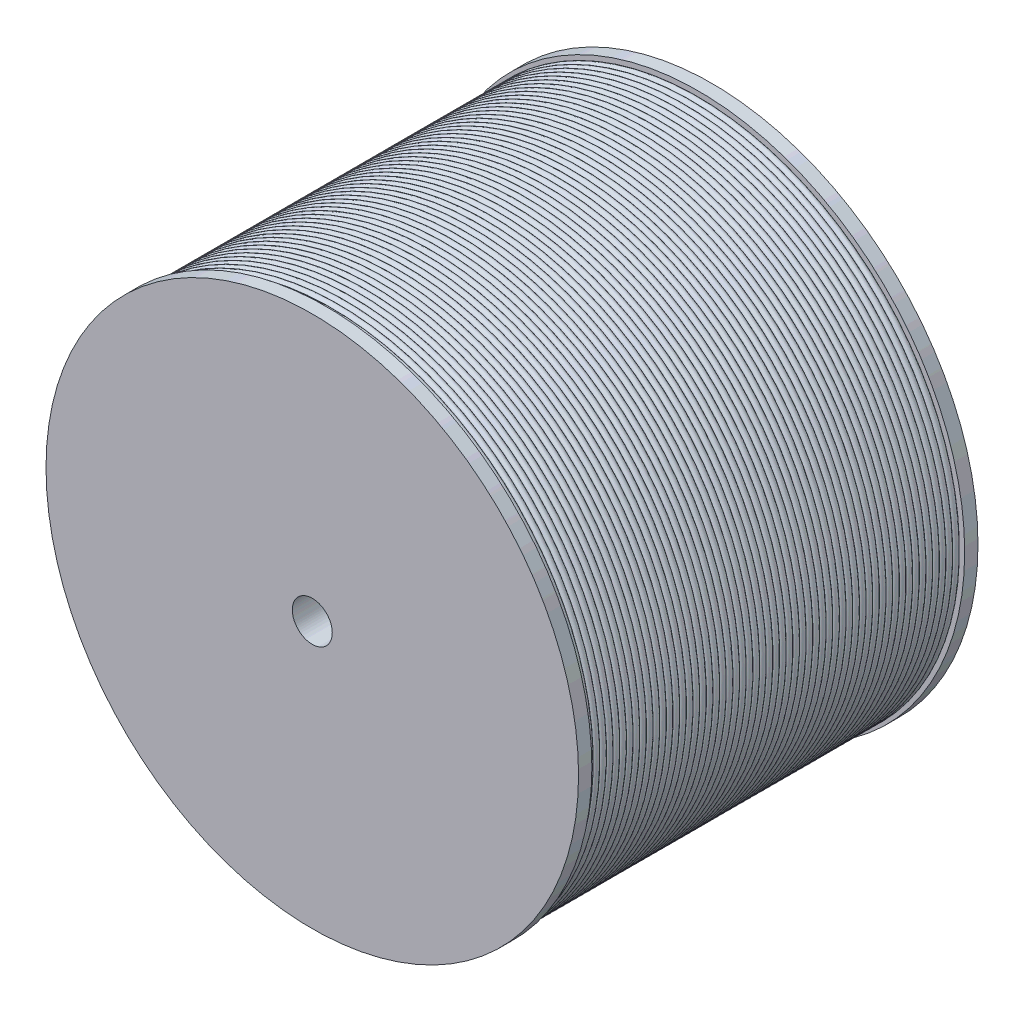
from build123d import *

# Parameters (mm, degrees)
SKETCH_3_R          = 3
CUT_EXTRUDE_1_DEPTH = 83.462112512


with BuildPart() as part:
    # Эскиз2 → Повернуть1 (revolve)
    with BuildSketch(Plane(origin=(0, 0, 0), x_dir=(0, 0, -1), z_dir=(1, 0, 0))):
        Polygon((0, 40), (0, 0), (60, 0), (60, 40), (58, 40), (58, 39), (58, 6), (2, 6), (2, 39), (2, 40), align=None)
    revolve(axis=Axis((0, 0, -60), (0, 0, 1)))

    # Эскиз2<4> → Повернуть2 (revolve)
    with BuildSketch(Plane(origin=(0, 0, 0), x_dir=(0, 0, -1), z_dir=(1, 0, 0))):
        with BuildLine():
            ThreePointArc((3, 39), (2.5, 39.5), (2, 39))
            Line((2, 39), (2, 6))
            Line((2, 6), (58, 6))
            Line((58, 6), (58, 39))
            ThreePointArc((58, 39), (57.5, 39.5), (57, 39))
            ThreePointArc((57, 39), (56.5, 39.5), (56, 39))
            ThreePointArc((56, 39), (55.5, 39.5), (55, 39))
            ThreePointArc((55, 39), (54.5, 39.5), (54, 39))
            ThreePointArc((54, 39), (53.5, 39.5), (53, 39))
            ThreePointArc((53, 39), (52.5, 39.5), (52, 39))
            ThreePointArc((52, 39), (51.5, 39.5), (51, 39))
            ThreePointArc((51, 39), (50.5, 39.5), (50, 39))
            ThreePointArc((50, 39), (49.5, 39.5), (49, 39))
            ThreePointArc((49, 39), (48.5, 39.5), (48, 39))
            ThreePointArc((48, 39), (47.5, 39.5), (47, 39))
            ThreePointArc((47, 39), (46.5, 39.5), (46, 39))
            ThreePointArc((46, 39), (45.5, 39.5), (45, 39))
            ThreePointArc((45, 39), (44.5, 39.5), (44, 39))
            ThreePointArc((44, 39), (43.5, 39.5), (43, 39))
            ThreePointArc((43, 39), (42.5, 39.5), (42, 39))
            ThreePointArc((42, 39), (41.5, 39.5), (41, 39))
            ThreePointArc((41, 39), (40.5, 39.5), (40, 39))
            ThreePointArc((40, 39), (39.5, 39.5), (39, 39))
            ThreePointArc((39, 39), (38.5, 39.5), (38, 39))
            ThreePointArc((38, 39), (37.5, 39.5), (37, 39))
            ThreePointArc((37, 39), (36.5, 39.5), (36, 39))
            ThreePointArc((36, 39), (35.5, 39.5), (35, 39))
            ThreePointArc((35, 39), (34.5, 39.5), (34, 39))
            ThreePointArc((34, 39), (33.5, 39.5), (33, 39))
            ThreePointArc((33, 39), (32.5, 39.5), (32, 39))
            ThreePointArc((32, 39), (31.5, 39.5), (31, 39))
            ThreePointArc((31, 39), (30.5, 39.5), (30, 39))
            ThreePointArc((30, 39), (29.5, 39.5), (29, 39))
            ThreePointArc((29, 39), (28.5, 39.5), (28, 39))
            ThreePointArc((28, 39), (27.5, 39.5), (27, 39))
            ThreePointArc((27, 39), (26.5, 39.5), (26, 39))
            ThreePointArc((26, 39), (25.5, 39.5), (25, 39))
            ThreePointArc((25, 39), (24.5, 39.5), (24, 39))
            ThreePointArc((24, 39), (23.5, 39.5), (23, 39))
            ThreePointArc((23, 39), (22.5, 39.5), (22, 39))
            ThreePointArc((22, 39), (21.5, 39.5), (21, 39))
            ThreePointArc((21, 39), (20.5, 39.5), (20, 39))
            ThreePointArc((20, 39), (19.5, 39.5), (19, 39))
            ThreePointArc((19, 39), (18.5, 39.5), (18, 39))
            ThreePointArc((18, 39), (17.5, 39.5), (17, 39))
            ThreePointArc((17, 39), (16.5, 39.5), (16, 39))
            ThreePointArc((16, 39), (15.5, 39.5), (15, 39))
            ThreePointArc((15, 39), (14.5, 39.5), (14, 39))
            ThreePointArc((14, 39), (13.5, 39.5), (13, 39))
            ThreePointArc((13, 39), (12.5, 39.5), (12, 39))
            ThreePointArc((12, 39), (11.5, 39.5), (11, 39))
            ThreePointArc((11, 39), (10.5, 39.5), (10, 39))
            ThreePointArc((10, 39), (9.5, 39.5), (9, 39))
            ThreePointArc((9, 39), (8.5, 39.5), (8, 39))
            ThreePointArc((8, 39), (7.5, 39.5), (7, 39))
            ThreePointArc((7, 39), (6.5, 39.5), (6, 39))
            ThreePointArc((6, 39), (5.5, 39.5), (5, 39))
            ThreePointArc((5, 39), (4.5, 39.5), (4, 39))
            ThreePointArc((4, 39), (3.5, 39.5), (3, 39))
        make_face()
    revolve(axis=Axis((0, 0, -60), (0, 0, 1)))

    # Эскиз3 → Вырез-Вытянуть1 (cut, through all)
    with BuildSketch(Plane.XY):
        Circle(SKETCH_3_R)
    extrude(amount=-CUT_EXTRUDE_1_DEPTH, mode=Mode.SUBTRACT)


solid = part.part
